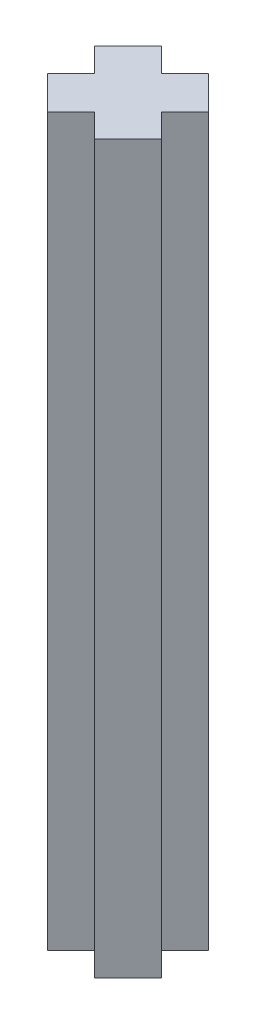
from build123d import *

# Parameters (mm, degrees)
BOSS_EXTRUDE1_DEPTH = 55.217391304
SCALE1_SCALE        = 0.92


with BuildPart() as part:
    # Sketch1 → Boss-Extrude1 (new body)
    with BuildSketch(Plane(origin=(0, 0, 0), x_dir=(1, 0, 0), z_dir=(0, 1, 0))):
        Polygon((-0.6269783, 2.91618698), (-2.423029524, 4.712238204), (-4.963029524, 2.172238204), (-3.1669783, 0.37618698), (-4.963029524, -1.419864244), (-2.423029524, -3.959864244), (-0.6269783, -2.16381302), (1.169072924, -3.959864244), (3.709072924, -1.419864244), (1.9130217, 0.37618698), (3.709072924, 2.172238204), (1.169072924, 4.712238204), align=None)
    extrude(amount=BOSS_EXTRUDE1_DEPTH)


with BuildPart() as part_1:
    # Scale1: scaled about (-0.6269783, 27.608695652, -0.37618698)
    add(part.part.scale(SCALE1_SCALE).moved(Location((-0.050158264, 2.208695652, -0.030094958))))


solid = part_1.part
